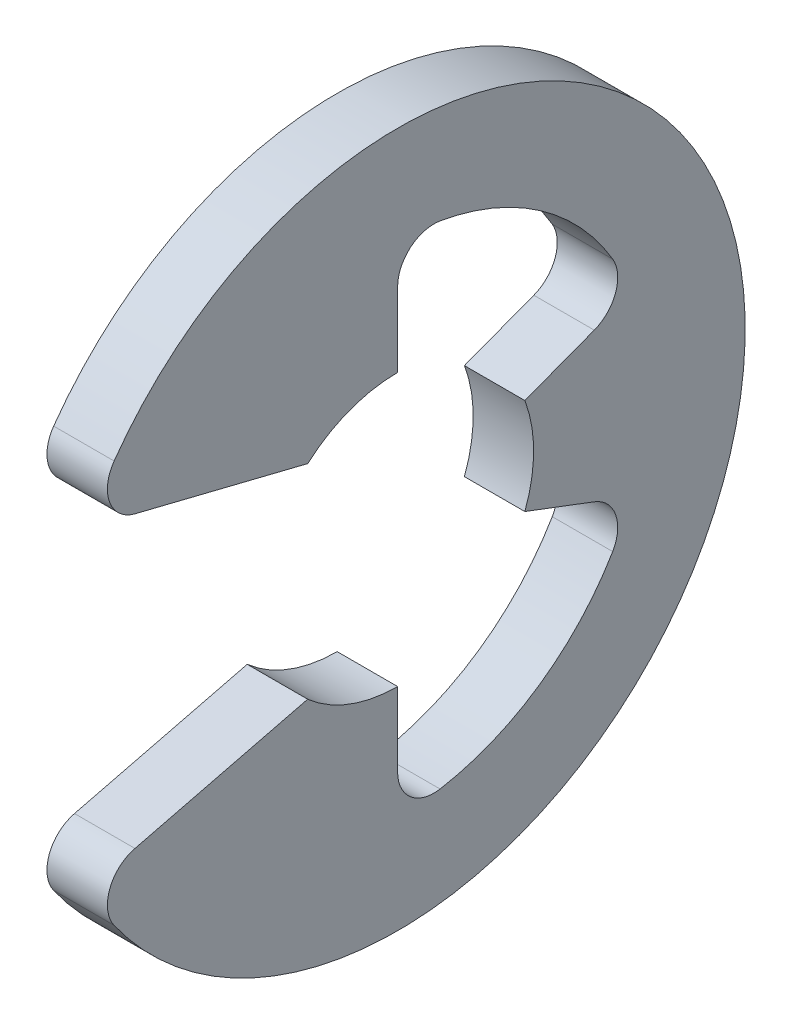
from build123d import *

# Parameters (mm, degrees)
EXTRUDE1_DEPTH = 0.3
FILLET1_R      = 0.36


with BuildPart() as part:
    # Sketch1 → Extrude1 (new, symmetric)
    with BuildSketch(Plane(origin=(0, 0, 0), x_dir=(0, 0, -1), z_dir=(1, 0, 0))):
        with BuildLine():
            Line((-3.079508789, -1.555353856), (-0.892941067, -1.0125))
            ThreePointArc((-0.892941067, -1.0125), (-0.477297077, -1.262809368), (0, -1.35))
            Line((0, -1.35), (0, -2.477419355))
            ThreePointArc((0, -2.477419355), (1.408480567, -2.038084677), (2.317413607, -0.875900013))
            Line((2.317413607, -0.875900013), (1.262809368, -0.477297077))
            ThreePointArc((1.262809368, -0.477297077), (1.35, 0), (1.262809368, 0.477297077))
            Line((1.262809368, 0.477297077), (2.317413607, 0.875900013))
            ThreePointArc((2.317413607, 0.875900013), (1.408480567, 2.038084677), (0, 2.477419355))
            Line((0, 2.477419355), (0, 1.35))
            ThreePointArc((0, 1.35), (-0.477297077, 1.262809368), (-0.892941067, 1.0125))
            Line((-0.892941067, 1.0125), (-3.079508789, 1.555353856))
            ThreePointArc((-3.079508789, 1.555353856), (3.45, 0), (-3.079508789, -1.555353856))
        make_face()
    extrude(amount=EXTRUDE1_DEPTH, both=True)

    # Fillet1
    fillet1_edges = [part.edges().sort_by_distance(p)[0] for p in [
        (0, -2.477419355, 0),
        (0, 2.477419355, 0),
        (0, -1.555353856, 3.079508789),
        (0, 1.555353856, 3.079508789),
        (0, -0.875900013, -2.317413607),
        (0, 0.875900013, -2.317413607),
    ]]
    fillet(fillet1_edges, radius=FILLET1_R)


solid = part.part
